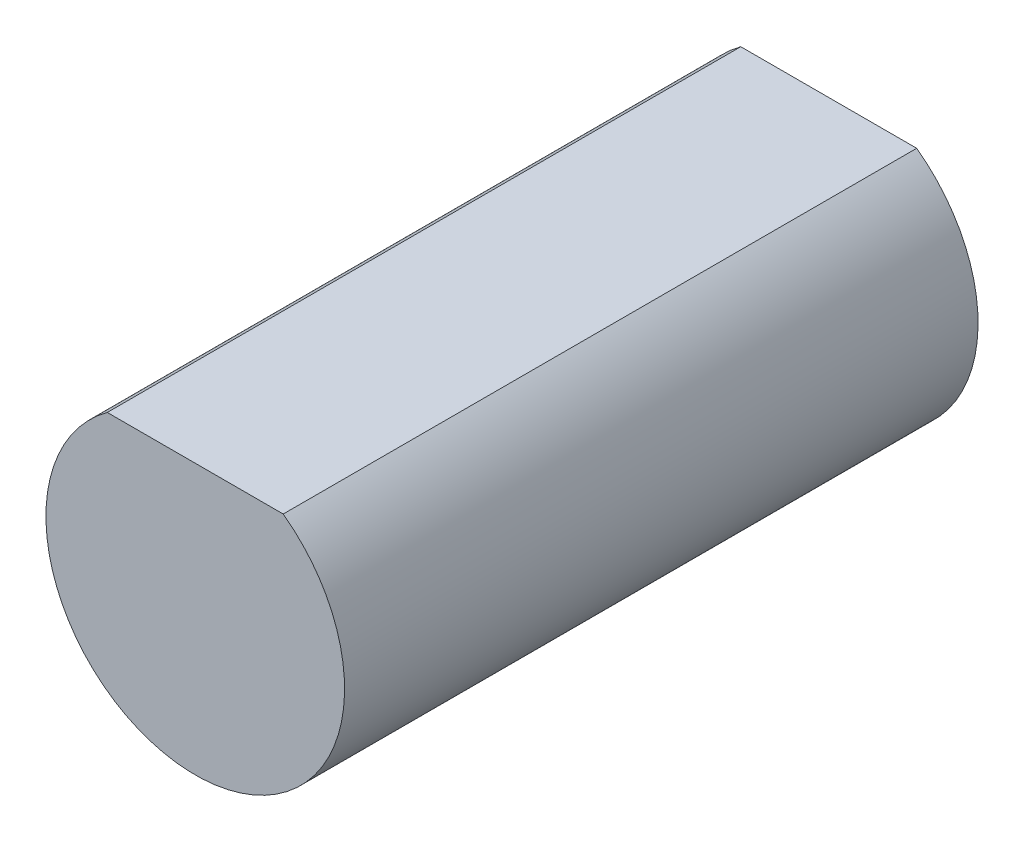
from build123d import *

# Parameters (mm, degrees)
SKETCH_1_R          = 9.9
EXTRUDE_1_DEPTH     = 42
CUT_EXTRUDE_1_DEPTH = 45.272113119


with BuildPart() as part:
    # 草图1 → 凸台-拉伸1 (new body)
    with BuildSketch(Plane.XY):
        Circle(SKETCH_1_R)
    extrude(amount=EXTRUDE_1_DEPTH)

    # 草图2 → 切除-拉伸1 (cut, through all)
    with BuildSketch(Plane.XY.offset(42)):
        with BuildLine():
            Line((-6, 8), (6, 8))
            ThreePointArc((6, 8), (0, 10), (-6, 8))
        make_face()
    extrude(amount=-CUT_EXTRUDE_1_DEPTH, mode=Mode.SUBTRACT)


solid = part.part
